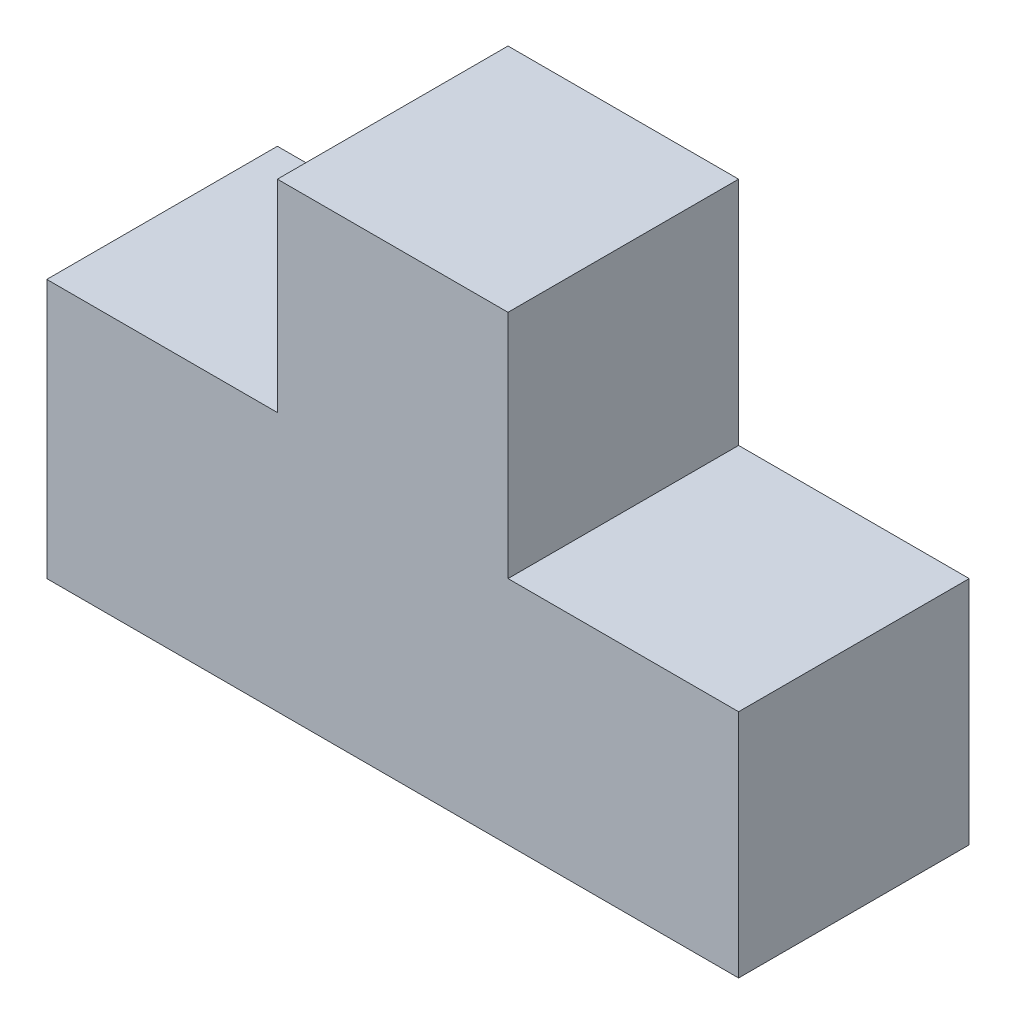
from build123d import *

# Parameters (mm, degrees)
BOSS_EXTRUDE1_DEPTH = 30


with BuildPart() as part:
    # Sketch1 → Boss-Extrude1 (new body)
    with BuildSketch(Plane.XY):
        Polygon((0, 0), (90, 0), (90, 30), (60, 30), (60, 60), (30, 60), (30, 33.707224335), (0, 33.707224335), align=None)
    extrude(amount=BOSS_EXTRUDE1_DEPTH)


solid = part.part
